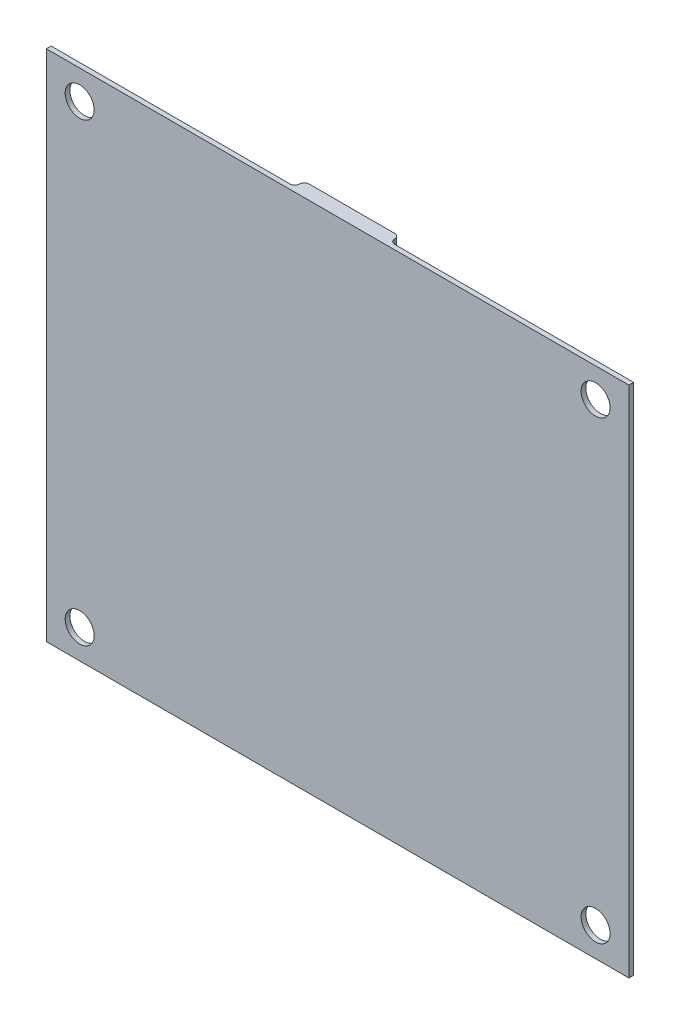
from build123d import *

# Parameters (mm, degrees)
CROQUIS1_W              = 245
CROQUIS1_H              = 215.984697531
CROQUIS1_R              = 6.1
SALIENTE_EXTRUIR1_DEPTH = 2
CROQUIS2_W              = 40
CROQUIS2_H              = 30
SALIENTE_EXTRUIR2_DEPTH = 4
REDONDEO1_R             = 2


with BuildPart() as part:
    # Croquis1 → Saliente-Extruir1 (new body)
    with BuildSketch(Plane.XY):
        with Locations((0, -173.507651235)):
            Rectangle(CROQUIS1_W, CROQUIS1_H)
        with Locations((-108.504553774, -269.266081741)):
            Circle(CROQUIS1_R, mode=Mode.SUBTRACT)
        with Locations((108.504553774, -269.266081741)):
            Circle(CROQUIS1_R, mode=Mode.SUBTRACT)
        with Locations((108.504553774, -77.749220728)):
            Circle(CROQUIS1_R, mode=Mode.SUBTRACT)
        with Locations((-108.504553774, -77.749220728)):
            Circle(CROQUIS1_R, mode=Mode.SUBTRACT)
    extrude(amount=SALIENTE_EXTRUIR1_DEPTH)

    # Croquis2 → Saliente-Extruir2 (add)
    with BuildSketch(Plane(origin=(0, 0, 0), x_dir=(-1, 0, 0), z_dir=(0, 0, -1))):
        with Locations((0, -80.515302469)):
            Rectangle(CROQUIS2_W, CROQUIS2_H)
    extrude(amount=SALIENTE_EXTRUIR2_DEPTH)

    # Redondeo1
    redondeo1_edges = [part.edges().sort_by_distance(p)[0] for p in [
        (-20, -80.515302469, -4),
        (-20, -80.515302469, 0),
        (0, -95.515302469, 0),
        (20, -80.515302469, 0),
        (0, -95.515302469, -4),
        (20, -80.515302469, -4),
    ]]
    fillet(redondeo1_edges, radius=REDONDEO1_R - 0.0001)  # a hair under: the kernel refuses the full size


solid = part.part
